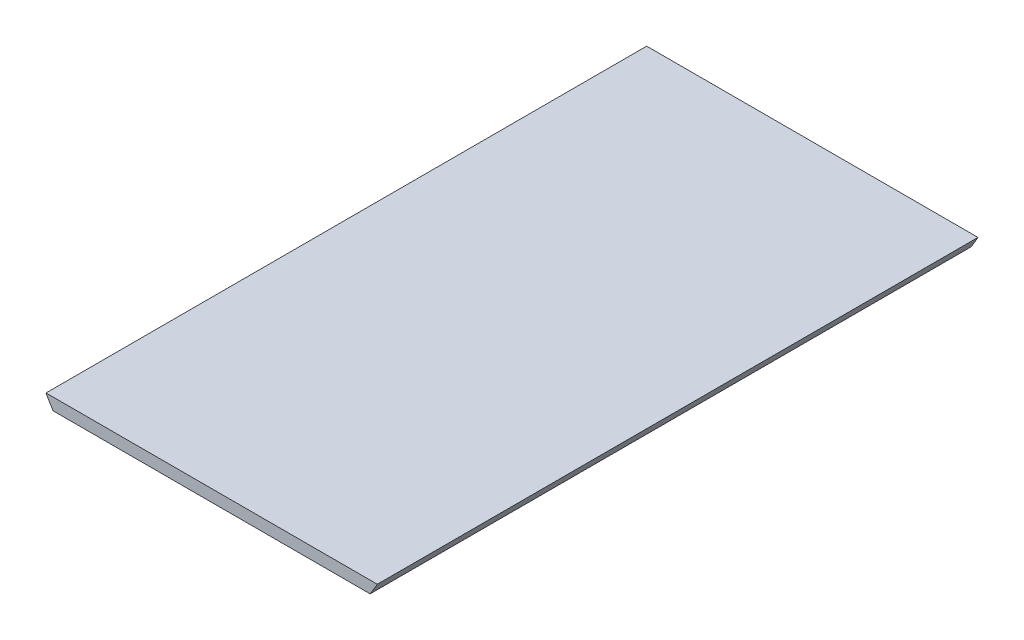
from build123d import *

# Parameters (mm, degrees)
BOSS_EXTRUDE1_DEPTH = 161.1884


with BuildPart() as part:
    # Sketch2 → Boss-Extrude1 (new body)
    with BuildSketch(Plane.XY):
        with BuildLine():
            Line((-44.45, -24.593444248), (44.45, -24.593444248))
            ThreePointArc((44.45, -24.593444248), (43.515559877, -26.211372506), (42.522255607, -27.793844248))
            Line((42.522255607, -27.793844248), (-42.522255607, -27.793844248))
            ThreePointArc((-42.522255607, -27.793844248), (-43.515559877, -26.211372506), (-44.45, -24.593444248))
        make_face()
    extrude(amount=BOSS_EXTRUDE1_DEPTH)


solid = part.part
